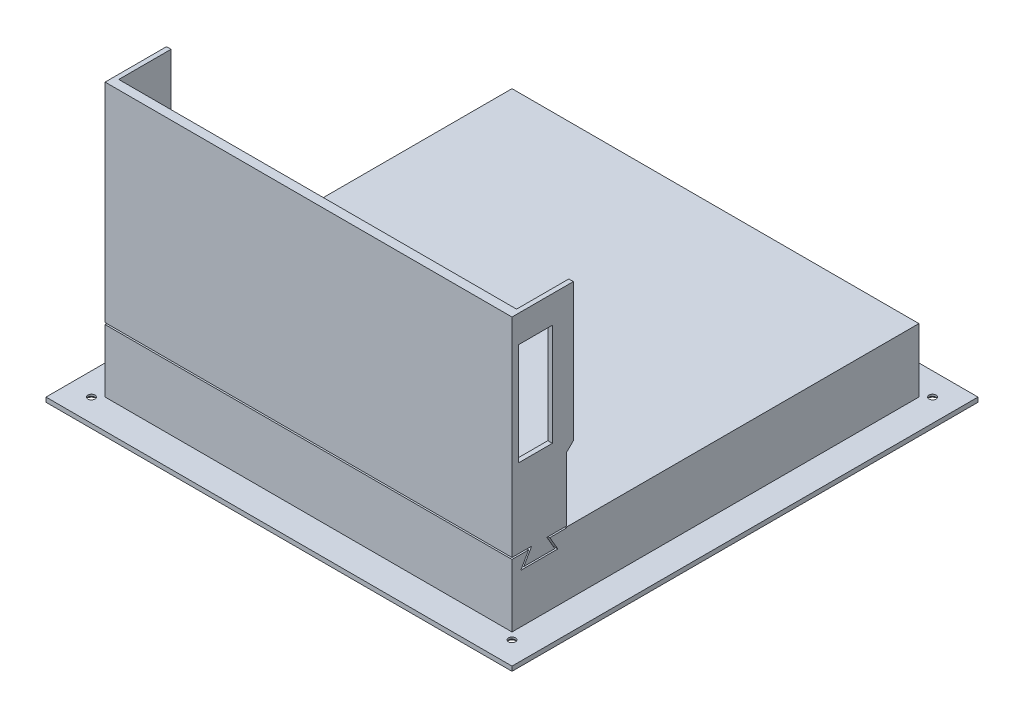
from build123d import *

# Parameters (mm, degrees)
SKETCH1_W                                      = 175
SKETCH1_H                                      = 175
BOSS_EXTRUDE1_DEPTH                            = 2
SKETCH2_W                                      = 8
SKETCH2_H                                      = 10
SKETCH2_W_2                                    = 12
SKETCH2_H_2                                    = 3.75
BOSS_EXTRUDE13_DEPTH                           = 23
SKETCH2_4_W                                    = 10
SKETCH2_4_H                                    = 8
SKETCH2_4_W_2                                  = 3.75
SKETCH2_4_H_2                                  = 12
BOSS_EXTRUDE14_DEPTH                           = 20
SKETCH2_5_W                                    = 10
SKETCH2_5_H                                    = 8
SKETCH2_5_W_2                                  = 3.75
SKETCH2_5_H_2                                  = 12
BOSS_EXTRUDE15_DEPTH                           = 22
SKETCH2_7_W                                    = 10
SKETCH2_7_H                                    = 8
SKETCH2_7_W_2                                  = 3.75
SKETCH2_7_H_2                                  = 12
BOSS_EXTRUDE19_DEPTH                           = 22
SKETCH2_8_W                                    = 3.75
SKETCH2_8_H                                    = 12
SKETCH2_8_W_2                                  = 10
SKETCH2_8_H_2                                  = 8
BOSS_EXTRUDE20_DEPTH                           = 5
BOSS_EXTRUDE7_DEPTH                            = 33
BOSS_EXTRUDE6_DEPTH                            = 30
SKETCH4_W                                      = 179
SKETCH4_H                                      = 179
SKETCH4_W_2                                    = 175
SKETCH4_H_2                                    = 175
BOSS_EXTRUDE3_DEPTH                            = 30
SKETCH15_W                                     = 179
SKETCH15_H                                     = 2
BOSS_EXTRUDE9_DEPTH                            = 90
SKETCH13_W                                     = 175
SKETCH13_H                                     = 20
CUT_EXTRUDE2_DEPTH                             = 2
SKETCH17_W                                     = 25
SKETCH17_H                                     = 5
SKETCH17_W_2                                   = 5
SKETCH17_H_2                                   = 12.7
BOSS_EXTRUDE11_DEPTH                           = 5
BOSS_EXTRUDE16_DEPTH                           = 2
BOSS_EXTRUDE17_DEPTH                           = 2
BOSS_EXTRUDE18_REACH                           = 220.64
SKETCH5_W                                      = 205
SKETCH5_H                                      = 205
SKETCH5_W_2                                    = 179
SKETCH5_H_2                                    = 179
BOSS_EXTRUDE4_DEPTH                            = 2
CSK_FOR_M2_5_FLAT_HEAD_MACHINE_SCREW1_AT_COUNT = 2
CSK_FOR_M2_5_FLAT_HEAD_MACHINE_SCREW1_AT_PITCH = 185
CSK_FOR_M2_5_FLAT_HEAD_MACHINE_SCREW_2_COUNT   = 2
CSK_FOR_M2_5_FLAT_HEAD_MACHINE_SCREW_2_PITCH   = 261.629509039
CSK_FOR_M2_5_FLAT_HEAD_MACHINE_SCREW_3_COUNT   = 2
CSK_FOR_M2_5_FLAT_HEAD_MACHINE_SCREW_3_PITCH   = 185
SKETCH21_W                                     = 175
SKETCH21_H                                     = 19
BOSS_EXTRUDE12_DEPTH                           = 2
CUT_EXTRUDE3_REACH                             = 239.079
SKETCH22_W                                     = 15
SKETCH22_H                                     = 45
CUT_EXTRUDE_THIN1_DEPTH                        = 238.078573473
CHAMFER1_SIZE                                  = 5
CHAMFER2_SIZE                                  = 5
CHAMFER3_SIZE                                  = 5
CHAMFER4_SIZE                                  = 2
SKETCH29_W                                     = 175
SKETCH29_H                                     = 92
CUT_EXTRUDE4_DEPTH                             = 5


with BuildPart() as part:
    # Sketch1 → Boss-Extrude1 (new body)
    with BuildSketch(Plane(origin=(0, 0, 0), x_dir=(1, 0, 0), z_dir=(0, 1, 0))):
        Rectangle(SKETCH1_W, SKETCH1_H)
    extrude(amount=BOSS_EXTRUDE1_DEPTH)

    # Sketch2 → Boss-Extrude13 (add)
    with BuildSketch(Plane(origin=(0, 0, 0), x_dir=(1, 0, 0), z_dir=(0, 1, 0))):
        with Locations((8.5, 54.625)):
            Rectangle(SKETCH2_W, SKETCH2_H)
        with Locations((61.5, 54.625)):
            Rectangle(SKETCH2_W, SKETCH2_H)
        with Locations((38.5, 69.625)):
            Rectangle(SKETCH2_W_2, SKETCH2_H_2)
        with Locations((38.5, 49.375)):
            Rectangle(SKETCH2_W_2, SKETCH2_H_2)
    extrude(amount=-BOSS_EXTRUDE13_DEPTH)

    # Sketch2<4> → Boss-Extrude14 (add)
    with BuildSketch(Plane(origin=(0, 0, 0), x_dir=(1, 0, 0), z_dir=(0, 1, 0))):
        with Locations((-66.125, -52.5)):
            Rectangle(SKETCH2_4_W, SKETCH2_4_H)
        with Locations((-81.125, -39.5)):
            Rectangle(SKETCH2_4_W_2, SKETCH2_4_H_2)
        with Locations((-51.125, -39.5)):
            Rectangle(SKETCH2_4_W_2, SKETCH2_4_H_2)
        with Locations((-66.125, -24.5)):
            Rectangle(SKETCH2_4_W, SKETCH2_4_H)
    extrude(amount=-BOSS_EXTRUDE14_DEPTH)

    # Sketch2<5> → Boss-Extrude15 (add)
    with BuildSketch(Plane(origin=(0, 0, 0), x_dir=(1, 0, 0), z_dir=(0, 1, 0))):
        with Locations((-27.625, 2.5)):
            Rectangle(SKETCH2_5_W, SKETCH2_5_H)
        with Locations((-42.625, 43)):
            Rectangle(SKETCH2_5_W_2, SKETCH2_5_H_2)
        with Locations((-27.625, 72.5)):
            Rectangle(SKETCH2_5_W, SKETCH2_5_H)
        with Locations((-12.625, 43)):
            Rectangle(SKETCH2_5_W_2, SKETCH2_5_H_2)
    extrude(amount=-BOSS_EXTRUDE15_DEPTH)

    # Sketch2<7> → Boss-Extrude19 (add)
    with BuildSketch(Plane(origin=(0, 0, 0), x_dir=(1, 0, 0), z_dir=(0, 1, 0))):
        with Locations((-65.624151737, 1.524939721)):
            Rectangle(SKETCH2_7_W, SKETCH2_7_H)
        with Locations((-50.623303474, 36.5)):
            Rectangle(SKETCH2_7_W_2, SKETCH2_7_H_2)
        with Locations((-80.625, 36.5)):
            Rectangle(SKETCH2_7_W_2, SKETCH2_7_H_2)
        with Locations((-65.624151737, 71.524939721)):
            Rectangle(SKETCH2_7_W, SKETCH2_7_H)
    extrude(amount=-BOSS_EXTRUDE19_DEPTH)

    # Sketch2<8> → Boss-Extrude20 (add)
    with BuildSketch(Plane(origin=(0, 0, 0), x_dir=(1, 0, 0), z_dir=(0, 1, 0))):
        with Locations((-42.625, 43)):
            Rectangle(SKETCH2_8_W, SKETCH2_8_H)
        with Locations((-12.625, 43)):
            Rectangle(SKETCH2_8_W, SKETCH2_8_H)
        with Locations((-27.625, 2.5)):
            Rectangle(SKETCH2_8_W_2, SKETCH2_8_H_2)
        with Locations((-27.625, 72.5)):
            Rectangle(SKETCH2_8_W_2, SKETCH2_8_H_2)
    extrude(amount=-BOSS_EXTRUDE20_DEPTH)

    # Sketch11 → Boss-Extrude7 (add)
    with BuildSketch(Plane.XZ):
        Polygon((19.5, -10.5), (-0.5, -10.5), (-0.5, -5.5), (19.5, -5.5), (19.5, 1.5), (24.5, 1.5), (24.5, -5.5), (79.5, -5.5), (79.5, -10.5), (24.5, -10.5), (24.5, -30.5), (19.5, -30.5), align=None)
    extrude(amount=BOSS_EXTRUDE7_DEPTH)

    # Sketch10 → Boss-Extrude6 (add)
    with BuildSketch(Plane.XZ):
        Polygon((10.5, 35.5), (-21.5, 35.5), (-21.5, 45.5), (10.5, 45.5), (10.5, 65.5), (17.5, 65.5), (17.5, 45.5), (72.5, 45.5), (72.5, 35.5), (17.5, 35.5), (17.5, 12.5), (10.5, 12.5), align=None)
    extrude(amount=BOSS_EXTRUDE6_DEPTH)

    # Sketch4 → Boss-Extrude3 (add)
    with BuildSketch(Plane.XZ.offset(-2)):
        Rectangle(SKETCH4_W, SKETCH4_H)
        Rectangle(SKETCH4_W_2, SKETCH4_H_2, mode=Mode.SUBTRACT)
    extrude(amount=BOSS_EXTRUDE3_DEPTH)

    # Sketch15 → Boss-Extrude9 (add)
    with BuildSketch(Plane(origin=(0, 2, 0), x_dir=(1, 0, 0), z_dir=(0, 1, 0))):
        with Locations((0, -88.5)):
            Rectangle(SKETCH15_W, SKETCH15_H)
    extrude(amount=BOSS_EXTRUDE9_DEPTH)

    # Sketch13 → Cut-Extrude2 (cut)
    with BuildSketch(Plane.XZ):
        with Locations((0, 77.5)):
            Rectangle(SKETCH13_W, SKETCH13_H)
    extrude(amount=-CUT_EXTRUDE2_DEPTH, mode=Mode.SUBTRACT)

    # Sketch17 → Boss-Extrude11 (add)
    with BuildSketch(Plane(origin=(0, 0, 87.5), x_dir=(-1, 0, 0), z_dir=(0, 0, -1))):
        with Locations((-75, 32.5)):
            Rectangle(SKETCH17_W, SKETCH17_H)
        Polygon((15.5, 35), (0.5, 35), (0.5, 30), (20.5, 30), (51.5, 30), (51.5, 10), (87.5, 10), (87.5, 15), (56.5, 15), (56.5, 35), (20.5, 35), (20.5, 50), (15.5, 50), align=None)
        with Locations((16, 83.65)):
            Rectangle(SKETCH17_W_2, SKETCH17_H_2)
    extrude(amount=BOSS_EXTRUDE11_DEPTH)

    # Sketch26 → Boss-Extrude17 (add)
    with BuildSketch(Plane.ZY.offset(89.5)):
        Polygon((65.5, 2), (65.5, 30.408609963), (62.5, 33.408609963), (62.5, 92), (87.5, 92), (87.5, 2), align=None)
    extrude(amount=-BOSS_EXTRUDE17_DEPTH)


with BuildPart() as body_2:
    # Sketch24 → Boss-Extrude16 (new body)
    with BuildSketch(Plane(origin=(89.5, 0, 0), x_dir=(0, 0, -1), z_dir=(1, 0, 0))):
        Polygon((-65.5, 2), (-65.5, 30.408609963), (-62.5, 33.408609963), (-62.5, 92), (-87.5, 92), (-87.5, 2), align=None)
    extrude(amount=-BOSS_EXTRUDE16_DEPTH)

    # Sketch27 → Boss-Extrude18 (add, up to next)
    with BuildSketch(Plane(origin=(-87.5, 0, 0), x_dir=(0, 0, -1), z_dir=(1, 0, 0)), mode=Mode.PRIVATE) as boss_extrude18_sk1:
        Polygon((-64.5, 34.237037088), (-67.5, 31.237037088), (-67.5, 2), (-65.5, 2), (-65.5, 30.408609963), (-62.5, 33.408609963), (-62.5, 92), (-64.5, 92), align=None)
    boss_extrude18_tool1 = extrude(boss_extrude18_sk1.sketch, amount=BOSS_EXTRUDE18_REACH, mode=Mode.PRIVATE) - body_2.part

    add(part.part)  # Boss-Extrude18 merges part
    add(boss_extrude18_tool1.solids().sort_by_distance((-87.5, 32.09966, 65.362623))[0])

    # Sketch5 → Boss-Extrude4 (add)
    with BuildSketch(Plane.XZ.offset(28)):
        Rectangle(SKETCH5_W, SKETCH5_H)
        Rectangle(SKETCH5_W_2, SKETCH5_H_2, mode=Mode.SUBTRACT)
    extrude(amount=-BOSS_EXTRUDE4_DEPTH)

    # Sketch7 → CSK for M2.5 Flat Head Machine Screw1 (revolve, cut)
    with BuildSketch(Plane(origin=(92.5, -28, -92.5), x_dir=(0, 0, -1), z_dir=(1, 0, 0))):
        Polygon((0, 0), (0, 2), (1.55, 2), (1.55, 1.2), (2.75, 0), align=None)
    csk_for_m2_5_flat_head_machine_screw1 = revolve(axis=Axis((92.5, -34.35, -92.5), (0, 1, 0)), mode=Mode.SUBTRACT)

    # CSK for M2.5 Flat Head Machine Screw1 at: CSK for M2.5 Flat Head Machine Screw1 ×2
    with Locations(*[(-i * CSK_FOR_M2_5_FLAT_HEAD_MACHINE_SCREW1_AT_PITCH, 0, 0) for i in range(1, CSK_FOR_M2_5_FLAT_HEAD_MACHINE_SCREW1_AT_COUNT)]):
        add(csk_for_m2_5_flat_head_machine_screw1, mode=Mode.SUBTRACT)

    # CSK for M2.5 Flat Head Machine Screw 2: CSK for M2.5 Flat Head Machine Screw1 ×2
    with Locations(*[Vector(-0.7071067811865476, 0, 0.7071067811865476) * (i * CSK_FOR_M2_5_FLAT_HEAD_MACHINE_SCREW_2_PITCH) for i in range(1, CSK_FOR_M2_5_FLAT_HEAD_MACHINE_SCREW_2_COUNT)]):
        add(csk_for_m2_5_flat_head_machine_screw1, mode=Mode.SUBTRACT)

    # CSK for M2.5 Flat Head Machine Screw 3: CSK for M2.5 Flat Head Machine Screw1 ×2
    with Locations(*[(0, 0, i * CSK_FOR_M2_5_FLAT_HEAD_MACHINE_SCREW_3_PITCH) for i in range(1, CSK_FOR_M2_5_FLAT_HEAD_MACHINE_SCREW_3_COUNT)]):
        add(csk_for_m2_5_flat_head_machine_screw1, mode=Mode.SUBTRACT)

    # Sketch21 → Boss-Extrude12 (add)
    with BuildSketch(Plane(origin=(0, 92, 0), x_dir=(1, 0, 0), z_dir=(0, 1, 0))):
        Polygon((-89.5, -89.5), (89.5, -89.5), (89.5, -85.5), (89.5, -69.5), (89.5, -62.5), (-89.5, -62.5), (-89.5, -66.5), (-89.5, -85.5), align=None)
        with Locations((0, -76)):
            Rectangle(SKETCH21_W, SKETCH21_H, mode=Mode.SUBTRACT)
    extrude(amount=BOSS_EXTRUDE12_DEPTH)

    # Sketch22 → Cut-Extrude3 (cut, up to next)
    with BuildSketch(Plane(origin=(89.5, 0, 0), x_dir=(0, 0, -1), z_dir=(1, 0, 0)), mode=Mode.PRIVATE) as cut_extrude3_sk1:
        with Locations((-79.25, 59.5)):
            Rectangle(SKETCH22_W, SKETCH22_H)
    cut_extrude3_tool1 = extrude(cut_extrude3_sk1.sketch, amount=-CUT_EXTRUDE3_REACH, mode=Mode.PRIVATE) & body_2.part
    add(cut_extrude3_tool1.solids().sort_by_distance((89.5, 59.5, 79.25))[0], mode=Mode.SUBTRACT)

    # Sketch28 → Cut-Extrude-Thin1 (cut, through all)
    with BuildSketch(Plane(origin=(89.5, 0, 0), x_dir=(0, 0, -1), z_dir=(1, 0, 0))):
        Polygon((-65.5, 2.375), (-74.149519053, 2.375), (-70.649519053, -3.687177826), (-84.350480947, -3.687177826), (-80.850480947, 2.375), (-89.5, 2.375), (-89.5, 1.625), (-82.149519053, 1.625), (-85.649519053, -4.437177826), (-69.350480947, -4.437177826), (-72.850480947, 1.625), (-65.5, 1.625), align=None)
    extrude(amount=-CUT_EXTRUDE_THIN1_DEPTH, mode=Mode.SUBTRACT)


with BuildPart() as cut_extrude_thin1_piece_1:
    # of the separate pieces the step leaves, piece 1, a body of its own (cut_extrude_thin1_pieces)
    add(body_2.part.solids().sort_by_distance((-87.5, 0, 67.5))[0])


with BuildPart() as cut_extrude_thin1_piece_2:
    # of the separate pieces the step leaves, piece 2, a body of its own (cut_extrude_thin1_pieces)
    add(body_2.part.solids().sort_by_distance((-87.5, 2.375, 67.5))[0])

    # Chamfer1
    chamfer1_edges = [cut_extrude_thin1_piece_2.edges().sort_by_distance(p)[0] for p in [
        (-69.5, 10, 87.5),
    ]]
    chamfer(chamfer1_edges, length=CHAMFER1_SIZE - 0.0001)  # a hair under: the kernel refuses the full size

    # Chamfer2
    chamfer2_edges = [cut_extrude_thin1_piece_2.edges().sort_by_distance(p)[0] for p in [
        (-26, 30, 87.5),
    ]]
    chamfer(chamfer2_edges, length=CHAMFER2_SIZE - 0.0001)  # a hair under: the kernel refuses the full size

    # Chamfer3
    chamfer3_edges = [cut_extrude_thin1_piece_2.edges().sort_by_distance(p)[0] for p in [
        (75, 30, 87.5),
        (-16, 77.3, 87.5),
    ]]
    chamfer(chamfer3_edges, length=CHAMFER3_SIZE - 0.0001)  # a hair under: the kernel refuses the full size

    # Chamfer4
    chamfer4_edges = [cut_extrude_thin1_piece_2.edges().sort_by_distance(p)[0] for p in [
        (0, 92, 87.5),
        (0, 92, 64.5),
    ]]
    chamfer(chamfer4_edges, length=CHAMFER4_SIZE - 0.0001)  # a hair under: the kernel refuses the full size

    # Sketch29 → Cut-Extrude4 (cut)
    with BuildSketch(Plane(origin=(0, 0, 62.5), x_dir=(-1, 0, 0), z_dir=(0, 0, -1))):
        with Locations((0, 48)):
            Rectangle(SKETCH29_W, SKETCH29_H)
    extrude(amount=-CUT_EXTRUDE4_DEPTH, mode=Mode.SUBTRACT)


solid = Compound([cut_extrude_thin1_piece_1.part, cut_extrude_thin1_piece_2.part])
